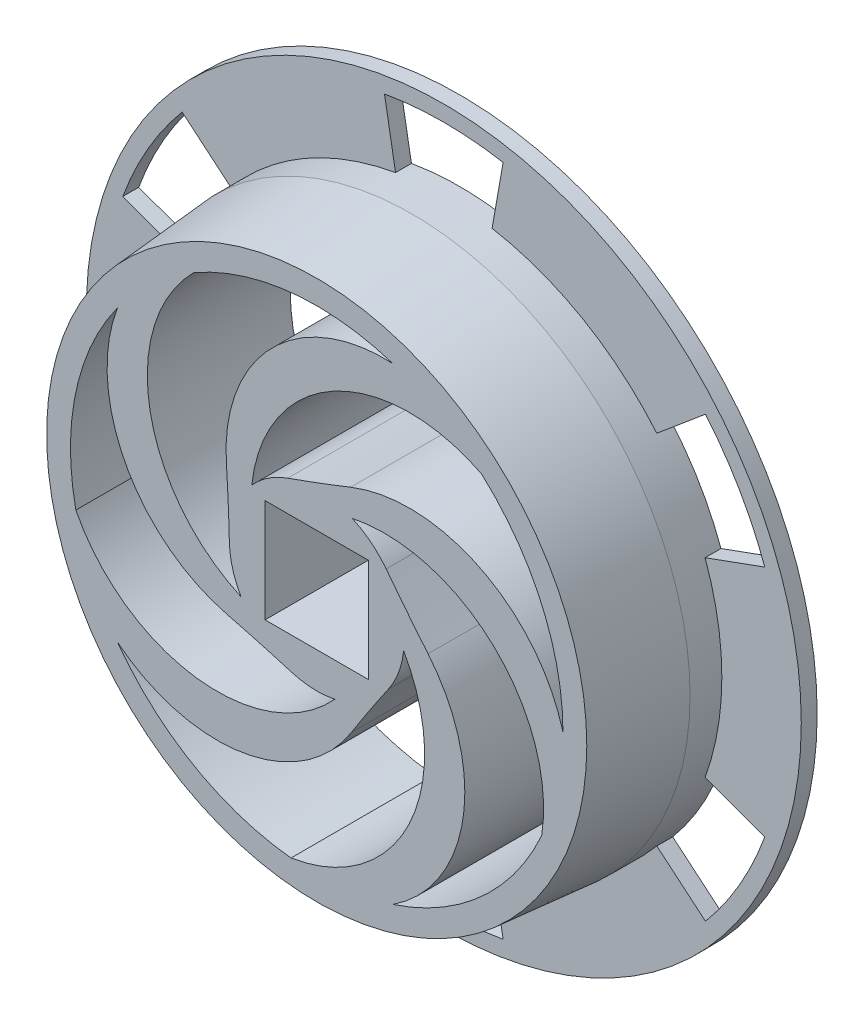
from build123d import *

# Parameters (mm, degrees)
SKETCH1_R           = 22.5
BOSS_EXTRUDE1_DEPTH = 3
SKETCH2_R           = 17.5
BOSS_EXTRUDE2_DEPTH = 6
CHAMFER1_SIZE       = 6
CHAMFER1_SIZE_2     = 0.5
CUT_EXTRUDE1_REACH  = 35.068
FILLET1_R           = 100
CUT_EXTRUDE2_REACH  = 35.068
SKETCH4_W           = 6.5
SKETCH4_H           = 6.5
CUT_EXTRUDE3_START  = -2
SKETCH6_R           = 22.5
SKETCH6_R_2         = 17.5
CUT_EXTRUDE3_DEPTH  = 2
CUT_EXTRUDE4_REACH  = 34.81
CIRPATTERN1_COUNT   = 6


with BuildPart() as part:
    # Sketch1 → Boss-Extrude1 (new body)
    with BuildSketch(Plane.XY):
        Circle(SKETCH1_R)
    extrude(amount=BOSS_EXTRUDE1_DEPTH)

    # Sketch2 → Boss-Extrude2 (add)
    with BuildSketch(Plane.XY.offset(3)):
        Circle(SKETCH2_R)
    extrude(amount=BOSS_EXTRUDE2_DEPTH)

    # Chamfer1
    # the kernel refuses this chamfer: 6, 0.5 mm, written as the material it takes off along each edge
    with BuildSketch(Plane(origin=(0, 0, 9), x_dir=(1, 0, 0), z_dir=(0, -1, 0))) as chamfer1_piece_1_section:
        Polygon((17.5, -CHAMFER1_SIZE), (17.5 - CHAMFER1_SIZE_2, 0), (17.5, 0), align=None)
    chamfer1_piece_1 = revolve(axis=Axis((0, 0, 9), (0, 0, 1)), mode=Mode.PRIVATE)
    chamfer1_piece_1 = split(chamfer1_piece_1, bisect_by=Plane(origin=(-17.303133917, 0, 3), z_dir=(0, 0, 1)), keep=Keep.TOP, mode=Mode.PRIVATE)
    add(chamfer1_piece_1, mode=Mode.SUBTRACT)

    # Sketch3 → Cut-Extrude1 (cut, up to next)
    with BuildSketch(Plane.XY.offset(9), mode=Mode.PRIVATE) as cut_extrude1_sk1:
        with BuildLine():
            ThreePointArc((0, 5.5), (9.191338757, 6.81195468), (15.5, 0))
            ThreePointArc((15.5, 0), (14.159954593, 6.304417968), (10.371524399, 11.518744795))
            ThreePointArc((10.371524399, 11.518744795), (1.087937204, 11.388583202), (-4.08729654, 3.680218335))
            ThreePointArc((-4.08729654, 3.680218335), (-2.237051537, 5.024500017), (0, 5.5))
        make_face()
    cut_extrude1_tool1 = extrude(cut_extrude1_sk1.sketch, amount=-CUT_EXTRUDE1_REACH, mode=Mode.PRIVATE) & part.part
    # Sketch3 → Cut-Extrude1 (cut, up to next)
    with BuildSketch(Plane.XY.offset(9), mode=Mode.PRIVATE) as cut_extrude1_sk2:
        with BuildLine():
            ThreePointArc((14.159954593, -6.304417968), (11.167377351, 2.484575984), (2.237051537, 5.024500017))
            ThreePointArc((2.237051537, 5.024500017), (4.08729654, 3.680218335), (5.23081084, 1.699593469))
            ThreePointArc((5.23081084, 1.699593469), (9.318833764, -6.636472858), (4.789763413, -14.741376003))
            ThreePointArc((4.789763413, -14.741376003), (10.371524399, -11.518744795), (14.159954593, -6.304417968))
        make_face()
    cut_extrude1_tool2 = extrude(cut_extrude1_sk2.sketch, amount=-CUT_EXTRUDE1_REACH, mode=Mode.PRIVATE) & part.part
    # Sketch3 → Cut-Extrude1 (cut, up to next)
    with BuildSketch(Plane.XY.offset(9), mode=Mode.PRIVATE) as cut_extrude1_sk3:
        with BuildLine():
            ThreePointArc((-5.23081084, 1.699593469), (-3.63827401, 10.84649238), (4.789763413, 14.741376003))
            ThreePointArc((4.789763413, 14.741376003), (-1.620191181, 15.415089378), (-7.75, 13.423393759))
            ThreePointArc((-7.75, 13.423393759), (-10.494995181, 4.553955519), (-4.763139721, -2.75))
            ThreePointArc((-4.763139721, -2.75), (-5.469870425, -0.574906548), (-5.23081084, 1.699593469))
        make_face()
    cut_extrude1_tool3 = extrude(cut_extrude1_sk3.sketch, amount=-CUT_EXTRUDE1_REACH, mode=Mode.PRIVATE) & part.part
    # Sketch3 → Cut-Extrude1 (cut, up to next)
    with BuildSketch(Plane.XY.offset(9), mode=Mode.PRIVATE) as cut_extrude1_sk4:
        with BuildLine():
            ThreePointArc((-1.620191181, -15.415089378), (5.813881563, -9.853030796), (5.469870425, -0.574906548))
            ThreePointArc((5.469870425, -0.574906548), (4.763139721, -2.75), (3.232818888, -4.449593469))
            ThreePointArc((3.232818888, -4.449593469), (-3.431982756, -10.913520471), (-12.539763413, -9.110671411))
            ThreePointArc((-12.539763413, -9.110671411), (-7.75, -13.423393759), (-1.620191181, -15.415089378))
        make_face()
    cut_extrude1_tool4 = extrude(cut_extrude1_sk4.sketch, amount=-CUT_EXTRUDE1_REACH, mode=Mode.PRIVATE) & part.part
    # Sketch3 → Cut-Extrude1 (cut, up to next)
    with BuildSketch(Plane.XY.offset(9), mode=Mode.PRIVATE) as cut_extrude1_sk5:
        with BuildLine():
            ThreePointArc((-3.232818888, -4.449593469), (-11.439915756, -0.10845373), (-12.539763413, 9.110671411))
            ThreePointArc((-12.539763413, 9.110671411), (-15.161287811, 3.222631208), (-15.161287811, -3.222631208))
            ThreePointArc((-15.161287811, -3.222631208), (-7.574200938, -8.574083908), (1.143514299, -5.379811804))
            ThreePointArc((1.143514299, -5.379811804), (-1.143514299, -5.379811804), (-3.232818888, -4.449593469))
        make_face()
    cut_extrude1_tool5 = extrude(cut_extrude1_sk5.sketch, amount=-CUT_EXTRUDE1_REACH, mode=Mode.PRIVATE) & part.part
    add(cut_extrude1_tool1.solids().sort_by_distance((5.79241, 8.44736, 9))[0], mode=Mode.SUBTRACT)
    add(cut_extrude1_tool2.solids().sort_by_distance((9.82387, -2.898532, 9))[0], mode=Mode.SUBTRACT)
    add(cut_extrude1_tool3.solids().sort_by_distance((-6.243964, 8.119288, 9))[0], mode=Mode.SUBTRACT)
    add(cut_extrude1_tool4.solids().sort_by_distance((0.279075, -10.238752, 9))[0], mode=Mode.SUBTRACT)
    add(cut_extrude1_tool5.solids().sort_by_distance((-9.651392, -3.429365, 9))[0], mode=Mode.SUBTRACT)

    # Fillet1
    fillet1_edges = [part.edges().sort_by_distance(p)[0] for p in [
        (3.232818888, -4.449593469, 4.5),
        (5.23081084, 1.699593469, 4.5),
        (-5.23081084, 1.699593469, 4.5),
        (-3.232818888, -4.449593469, 4.5),
        (0, 5.5, 4.5),
    ]]
    fillet(fillet1_edges, radius=FILLET1_R)

    # Sketch4 → Cut-Extrude2 (cut, up to next)
    with BuildSketch(Plane.XY.offset(9), mode=Mode.PRIVATE) as cut_extrude2_sk1:
        Rectangle(SKETCH4_W, SKETCH4_H)
    cut_extrude2_tool1 = extrude(cut_extrude2_sk1.sketch, amount=-CUT_EXTRUDE2_REACH, mode=Mode.PRIVATE) & part.part
    add(cut_extrude2_tool1.solids().sort_by_distance((0, 0, 9))[0], mode=Mode.SUBTRACT)

    # Sketch6 → Cut-Extrude3 (cut)
    with BuildSketch(Plane.XY.offset(3).offset(CUT_EXTRUDE3_START)):
        Circle(SKETCH6_R)
        Circle(SKETCH6_R_2, mode=Mode.SUBTRACT)
    extrude(amount=CUT_EXTRUDE3_DEPTH, mode=Mode.SUBTRACT)

    # Sketch7 → Cut-Extrude4 (cut, up to next)
    with BuildSketch(Plane.XY.offset(1), mode=Mode.PRIVATE) as cut_extrude4_sk1:
        with BuildLine():
            Line((3.73343582, 21.17336669), (-3.73343582, 21.17336669))
            Line((-3.73343582, 21.17336669), (-3.038843109, 17.234135678))
            ThreePointArc((-3.038843109, 17.234135678), (0, 17.5), (3.038843109, 17.234135678))
            Line((3.038843109, 17.234135678), (3.73343582, 21.17336669))
        make_face()
    cut_extrude4_tool1 = extrude(cut_extrude4_sk1.sketch, amount=-CUT_EXTRUDE4_REACH, mode=Mode.PRIVATE) & part.part
    # Sketch7 → Cut-Extrude4 (cut, up to next)
    with BuildSketch(Plane.XY.offset(1), mode=Mode.PRIVATE) as cut_extrude4_sk2:
        with BuildLine():
            ThreePointArc((3.73343582, 21.17336669), (0, 21.5), (-3.73343582, 21.17336669))
            Line((-3.73343582, 21.17336669), (3.73343582, 21.17336669))
        make_face()
    cut_extrude4_tool2 = extrude(cut_extrude4_sk2.sketch, amount=-CUT_EXTRUDE4_REACH, mode=Mode.PRIVATE) & part.part
    cut_extrude4_1 = cut_extrude4_tool1.solids().sort_by_distance((0, 19.352452, 1))[0]
    add(cut_extrude4_1, mode=Mode.SUBTRACT)
    cut_extrude4_2 = cut_extrude4_tool2.solids().sort_by_distance((0, 21.304105, 1))[0]
    add(cut_extrude4_2, mode=Mode.SUBTRACT)
    cut_extrude4 = cut_extrude4_1 + cut_extrude4_2  # Cut-Extrude4 as one shape, for the pattern or mirror that repeats it

    # CirPattern1: Cut-Extrude4 ×6 about axis
    cirpattern1_axis = Axis((0, 0, 0), (0, 0, 1))
    for i in range(1, CIRPATTERN1_COUNT):
        add(cut_extrude4.rotate(cirpattern1_axis, i * 360 / CIRPATTERN1_COUNT), mode=Mode.SUBTRACT)


solid = part.part
